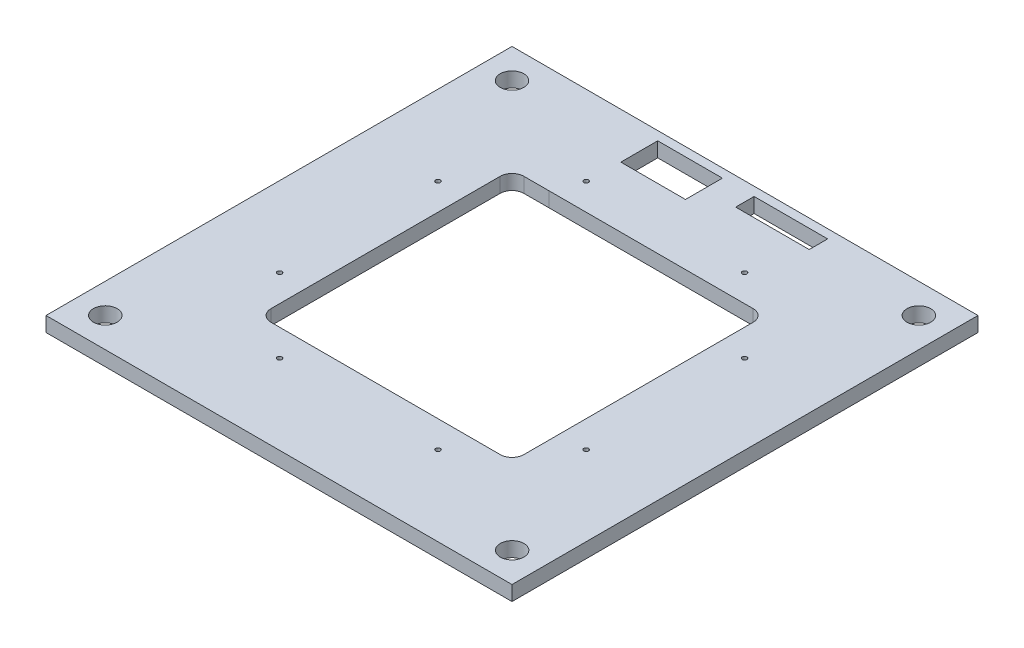
from build123d import *

# Parameters (mm, degrees)
SKETCH1_W           = 200.025
SKETCH1_H           = 200.025
SKETCH1_R           = 5.08
SKETCH1_R_2         = 1
SKETCH1_W_2         = 27.758924323
SKETCH1_H_2         = 15.850492031
SKETCH1_W_3         = 31.563171913
SKETCH1_H_3         = 7.913427648
BOSS_EXTRUDE1_DEPTH = 6.35
FILLET1_R           = 5.08


with BuildPart() as part:
    # Sketch1 → Boss-Extrude1 (new body)
    with BuildSketch(Plane(origin=(0, 0, 0), x_dir=(1, 0, 0), z_dir=(0, 1, 0))):
        with Locations((0, -0.023636735)):
            Rectangle(SKETCH1_W, SKETCH1_H)
        with Locations((-87.3125, 87.288863265)):
            Circle(SKETCH1_R, mode=Mode.SUBTRACT)
        with Locations((87.3125, 87.288863265)):
            Circle(SKETCH1_R, mode=Mode.SUBTRACT)
        with Locations((-87.3125, -87.288863265)):
            Circle(SKETCH1_R, mode=Mode.SUBTRACT)
        with Locations((87.3125, -87.288863265)):
            Circle(SKETCH1_R, mode=Mode.SUBTRACT)
        with Locations((34, 65.795)):
            Circle(SKETCH1_R_2, mode=Mode.SUBTRACT)
        with Locations((-34, 65.795)):
            Circle(SKETCH1_R_2, mode=Mode.SUBTRACT)
        with Locations((65.795, 34)):
            Circle(SKETCH1_R_2, mode=Mode.SUBTRACT)
        with Locations((65.795, -34)):
            Circle(SKETCH1_R_2, mode=Mode.SUBTRACT)
        with Locations((34, -65.795)):
            Circle(SKETCH1_R_2, mode=Mode.SUBTRACT)
        with Locations((-34, -65.795)):
            Circle(SKETCH1_R_2, mode=Mode.SUBTRACT)
        with Locations((-65.795, 34)):
            Circle(SKETCH1_R_2, mode=Mode.SUBTRACT)
        with Locations((-65.795, -34)):
            Circle(SKETCH1_R_2, mode=Mode.SUBTRACT)
        with Locations((-19.766444167, 88.253617249)):
            Rectangle(SKETCH1_W_2, SKETCH1_H_2, mode=Mode.SUBTRACT)
        with Locations((23.505506165, 92.222149441)):
            Rectangle(SKETCH1_W_3, SKETCH1_H_3, mode=Mode.SUBTRACT)
        Polygon((54.27, -38.5), (54.27, 38.5), (54.293636735, 54.27), (38.5, 54.27), (-38.5, 54.27), (-54.27, 54.246363265), (-54.27, 38.5), (-54.27, -38.5), (-54.27, -54.293636735), (-42.77, -54.27), (-38.5, -54.27), (38.5, -54.27), (42.77, -54.27), (54.246363265, -54.27), (54.27, -42.77), align=None, mode=Mode.SUBTRACT)
    extrude(amount=BOSS_EXTRUDE1_DEPTH)

    # Fillet1
    fillet1_edges = [part.edges().sort_by_distance(p)[0] for p in [
        (54.246363265, 3.175, 54.27),
        (-54.27, 3.175, 54.293636735),
        (54.293636735, 3.175, -54.27),
        (-54.27, 3.175, -54.246363265),
    ]]
    fillet(fillet1_edges, radius=FILLET1_R)


solid = part.part
